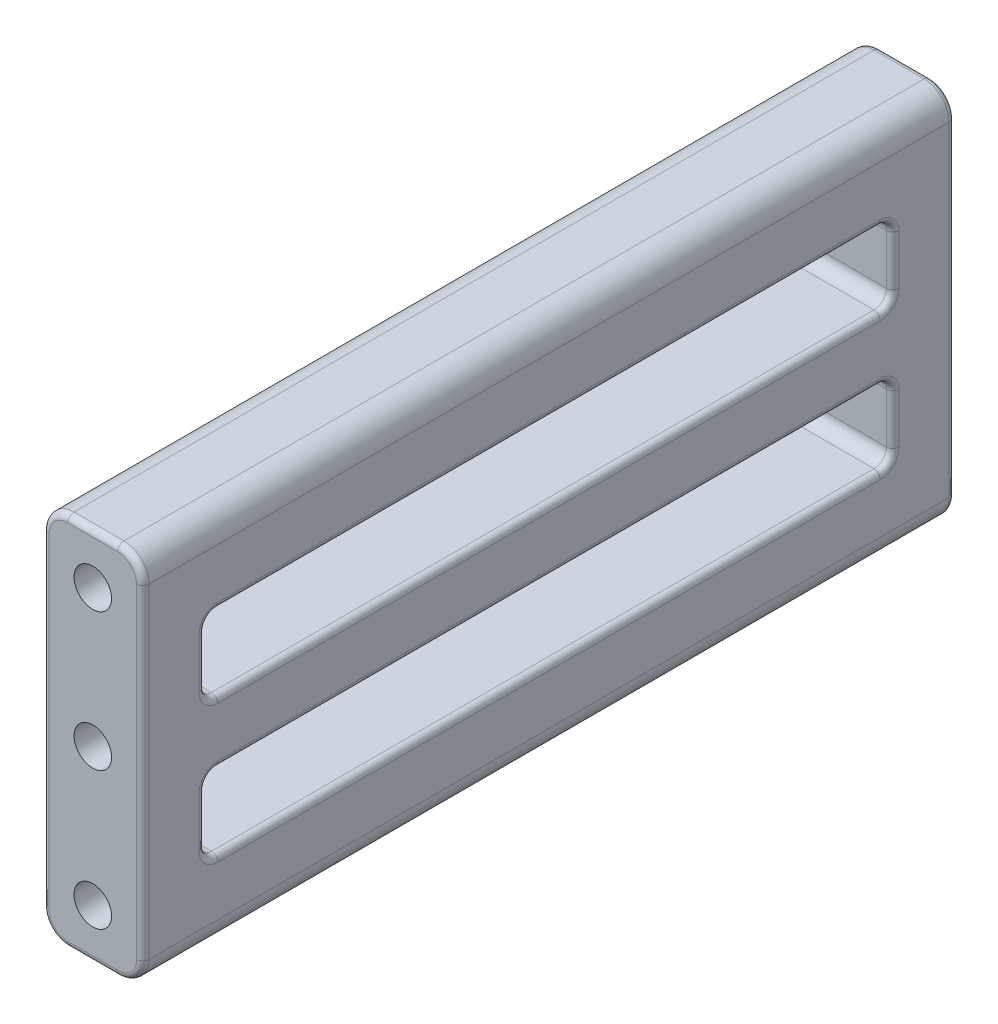
from build123d import *

# Parameters (mm, degrees)
SKETCH1_W           = 65
SKETCH1_H           = 30
BOSS_EXTRUDE1_DEPTH = 8
FILLET1_R           = 2
FILLET2_R           = 0.5
SKETCH2_R           = 1.5
CUT_EXTRUDE1_DEPTH  = 10
SKETCH3_W           = 55
SKETCH3_H           = 6
CUT_EXTRUDE2_DEPTH  = 10
FILLET3_R           = 1
FILLET4_R           = 0.5


with BuildPart() as part:
    # Sketch1 → Boss-Extrude1 (new body)
    with BuildSketch(Plane(origin=(0, 0, 0), x_dir=(0, 0, -1), z_dir=(1, 0, 0))):
        Rectangle(SKETCH1_W, SKETCH1_H)
    extrude(amount=BOSS_EXTRUDE1_DEPTH)

    # Fillet1
    fillet1_edges = [part.edges().sort_by_distance(p)[0] for p in [
        (8, -15, 0),
        (0, -15, 0),
        (0, 15, 0),
        (8, 15, 0),
    ]]
    fillet(fillet1_edges, radius=FILLET1_R)

    # Fillet2
    fillet2_edges = [part.edges().sort_by_distance(p)[0] for p in [
        (7.414213562, 14.414213562, -32.5),
        (4, 15, -32.5),
        (0.585786438, 14.414213562, -32.5),
        (0, 0, -32.5),
        (0.585786438, -14.414213562, -32.5),
        (4, -15, -32.5),
        (7.414213562, -14.414213562, -32.5),
        (8, 0, -32.5),
        (0.585786438, -14.414213562, 32.5),
        (0, 0, 32.5),
        (0.585786438, 14.414213562, 32.5),
        (4, 15, 32.5),
        (7.414213562, 14.414213562, 32.5),
        (8, 0, 32.5),
        (7.414213562, -14.414213562, 32.5),
        (4, -15, 32.5),
    ]]
    fillet(fillet2_edges, radius=FILLET2_R)

    # Sketch2 → Cut-Extrude1 (cut)
    with BuildSketch(Plane(origin=(0, 0, -32.5), x_dir=(-1, 0, 0), z_dir=(0, 0, -1))):
        with Locations((-4, 0)):
            Circle(SKETCH2_R)
        with Locations((-4, 11)):
            Circle(SKETCH2_R)
        with Locations((-4, -11)):
            Circle(SKETCH2_R)
    cut_extrude1 = extrude(amount=-CUT_EXTRUDE1_DEPTH, mode=Mode.SUBTRACT)

    # Sketch3 → Cut-Extrude2 (cut)
    with BuildSketch(Plane(origin=(8, 0, 0), x_dir=(0, 0, -1), z_dir=(1, 0, 0))):
        with Locations((0, 5.5)):
            Rectangle(SKETCH3_W, SKETCH3_H)
        with Locations((0, -5.5)):
            Rectangle(SKETCH3_W, SKETCH3_H)
    extrude(amount=-CUT_EXTRUDE2_DEPTH, mode=Mode.SUBTRACT)

    # Fillet3
    fillet3_edges = [part.edges().sort_by_distance(p)[0] for p in [
        (4, -8.5, -27.5),
        (4, -2.5, -27.5),
        (4, -8.5, 27.5),
        (4, -2.5, 27.5),
        (4, 2.5, -27.5),
        (4, 8.5, -27.5),
        (4, 2.5, 27.5),
        (4, 8.5, 27.5),
    ]]
    fillet(fillet3_edges, radius=FILLET3_R)

    # Fillet4
    fillet4_edges = [part.edges().sort_by_distance(p)[0] for p in [
        (0, -8.207106781, -27.207106781),
        (0, -8.5, 0),
        (0, -8.207106781, 27.207106781),
        (0, -5.5, 27.5),
        (0, -2.792893219, 27.207106781),
        (0, -2.5, 0),
        (0, -2.792893219, -27.207106781),
        (0, -5.5, -27.5),
        (0, 2.792893219, -27.207106781),
        (0, 2.5, 0),
        (0, 2.792893219, 27.207106781),
        (0, 5.5, 27.5),
        (0, 8.207106781, 27.207106781),
        (0, 8.5, 0),
        (0, 8.207106781, -27.207106781),
        (0, 5.5, -27.5),
        (8, -8.207106781, 27.207106781),
        (8, -8.5, 0),
        (8, -8.207106781, -27.207106781),
        (8, -5.5, -27.5),
        (8, -2.792893219, -27.207106781),
        (8, -2.5, 0),
        (8, -2.792893219, 27.207106781),
        (8, -5.5, 27.5),
        (8, 2.792893219, 27.207106781),
        (8, 2.5, 0),
        (8, 2.792893219, -27.207106781),
        (8, 5.5, -27.5),
        (8, 8.207106781, -27.207106781),
        (8, 8.5, 0),
        (8, 8.207106781, 27.207106781),
        (8, 5.5, 27.5),
    ]]
    fillet(fillet4_edges, radius=FILLET4_R)

    # Mirror1: Cut-Extrude1 across plane
    add(cut_extrude1.mirror(Plane.XY), mode=Mode.SUBTRACT)


solid = part.part
